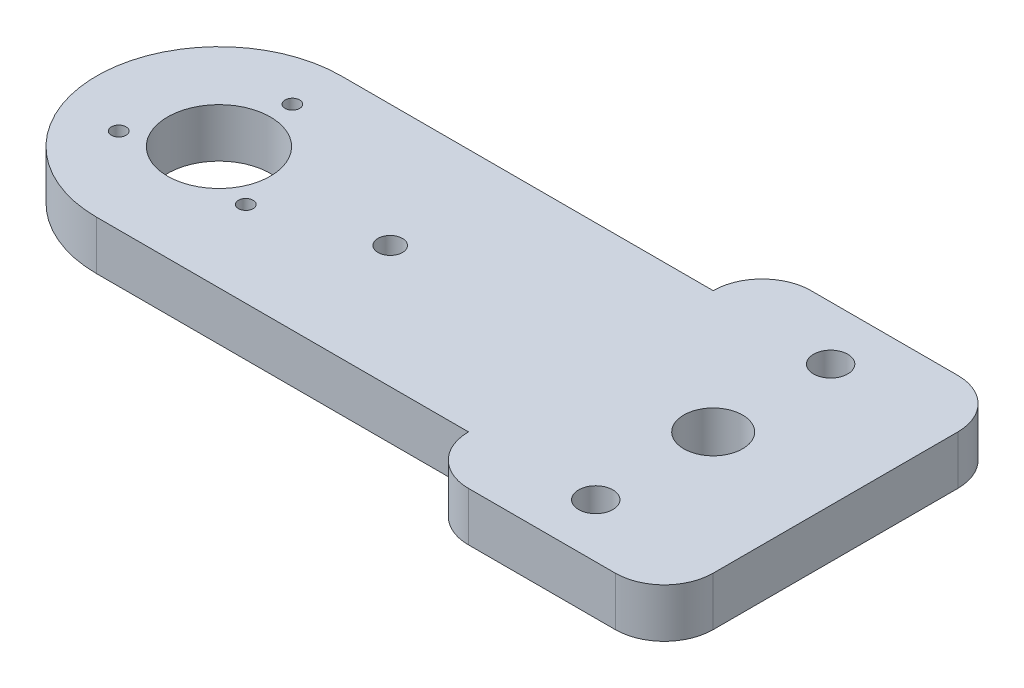
from build123d import *

# Parameters (mm, degrees)
SKETCH1_R           = 3.5
SKETCH1_R_2         = 6
SKETCH1_R_3         = 2.5
SKETCH1_R_4         = 1.5
SKETCH1_R_5         = 10.5
BOSS_EXTRUDE1_DEPTH = 10
FILLET1_R           = 10
FILLET2_R           = 10
FILLET3_R           = 10
FILLET4_R           = 10


with BuildPart() as part:
    # Sketch1 → Boss-Extrude1 (new body)
    with BuildSketch(Plane(origin=(0, 0, 0), x_dir=(1, 0, 0), z_dir=(0, 1, 0))):
        with BuildLine():
            Line((76.000002703, -25), (76.000002703, -35))
            Line((76.000002703, -35), (126.000002703, -35))
            Line((126.000002703, -35), (126.000002703, 35))
            Line((126.000002703, 35), (76.000002703, 35))
            Line((76.000002703, 35), (76.000002703, 25))
            Line((76.000002703, 25), (0, 25))
            ThreePointArc((0, 25), (-25, 0), (0, -25))
            Line((0, -25), (76.000002703, -25))
        make_face()
        with Locations(Location((101.000002703, 24, 0), (0, 0, 270))):
            Circle(SKETCH1_R, mode=Mode.SUBTRACT)
        with Locations(Location((101.000002703, -24, 0), (0, 0, 270))):
            Circle(SKETCH1_R, mode=Mode.SUBTRACT)
        with Locations(Location((101.000002703, 0, 0), (0, 0, 270))):
            Circle(SKETCH1_R_2, mode=Mode.SUBTRACT)
        with Locations(Location((35, 0, 0), (0, 0, 270))):
            Circle(SKETCH1_R_3, mode=Mode.SUBTRACT)
        with Locations(Location((0, 15, 0), (0, 0, 270))):
            Circle(SKETCH1_R_4, mode=Mode.SUBTRACT)
        with Locations(Location((12.990377534, -7.499997966, 0), (0, 0, 270))):
            Circle(SKETCH1_R_4, mode=Mode.SUBTRACT)
        with Locations(Location((-12.990376356, -7.500008143, 0), (0, 0, 270))):
            Circle(SKETCH1_R_4, mode=Mode.SUBTRACT)
        with Locations(Location((0, 0, 0), (0, 0, 270))):
            Circle(SKETCH1_R_5, mode=Mode.SUBTRACT)
    extrude(amount=BOSS_EXTRUDE1_DEPTH)

    # Fillet1
    fillet1_edges = [part.edges().sort_by_distance(p)[0] for p in [
        (126.000002703, 5, 35),
    ]]
    fillet(fillet1_edges, radius=FILLET1_R)

    # Fillet2
    fillet2_edges = [part.edges().sort_by_distance(p)[0] for p in [
        (76.000002703, 5, 35),
    ]]
    fillet(fillet2_edges, radius=FILLET2_R - 0.0001)  # a hair under: the kernel refuses the full size

    # Fillet3
    fillet3_edges = [part.edges().sort_by_distance(p)[0] for p in [
        (76.000002703, 5, -35),
    ]]
    fillet(fillet3_edges, radius=FILLET3_R - 0.0001)  # a hair under: the kernel refuses the full size

    # Fillet4
    fillet4_edges = [part.edges().sort_by_distance(p)[0] for p in [
        (126.000002703, 5, -35),
    ]]
    fillet(fillet4_edges, radius=FILLET4_R)


solid = part.part
